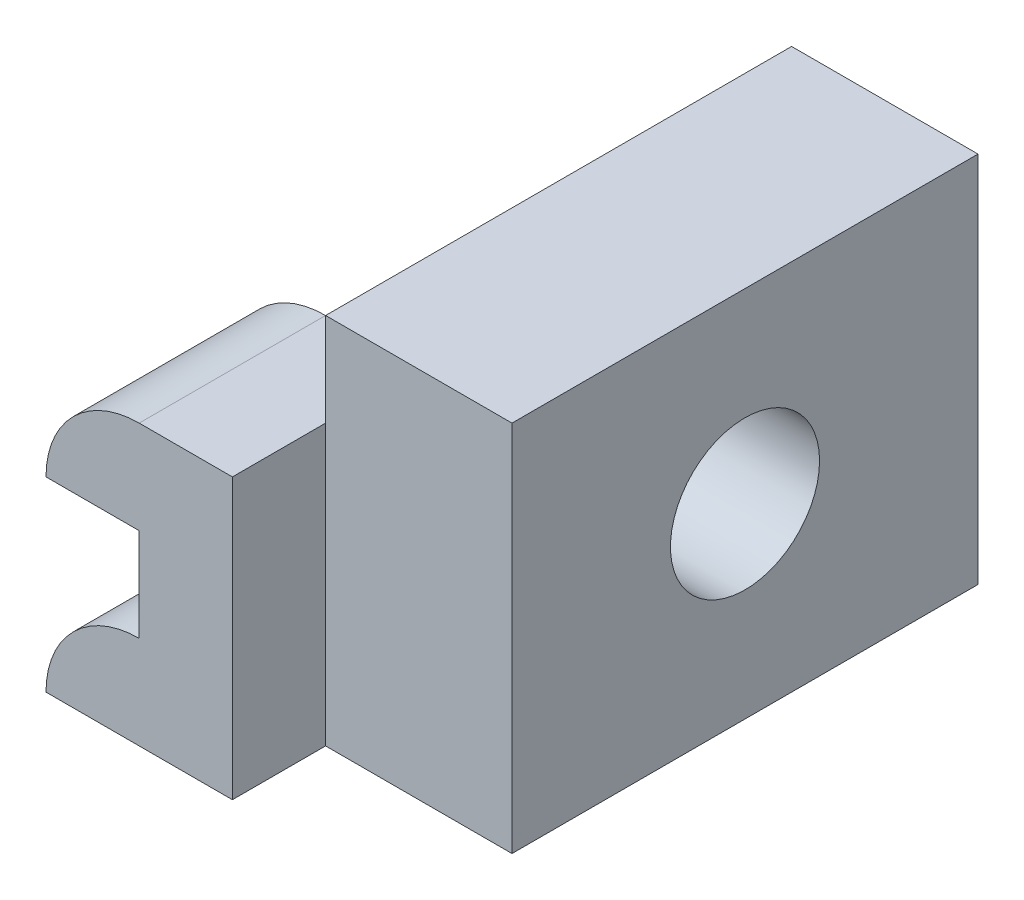
from build123d import *

# Parameters (mm, degrees)
BOSS_EXTRUDE1_DEPTH = 60
SKETCH2_W           = 40
SKETCH2_H           = 20
CUT_EXTRUDE1_DEPTH  = 20
FILLET1_R           = 10
FILLET2_R           = 10
SKETCH3_W           = 20
SKETCH3_H           = 40
CUT_EXTRUDE2_DEPTH  = 10
SKETCH4_R           = 8
CUT_EXTRUDE3_DEPTH  = 83.462112512


with BuildPart() as part:
    # Sketch1 → Boss-Extrude1 (new body)
    with BuildSketch(Plane.XY):
        Polygon((0, 0), (20, 0), (20, 40), (0, 40), (0, 30), (-20, 30), (-20, 20), (-10, 20), (-10, 10), (-20, 10), (-20, 0), align=None)
    extrude(amount=BOSS_EXTRUDE1_DEPTH)

    # Sketch2 → Cut-Extrude1 (cut)
    with BuildSketch(Plane.ZY.offset(20)):
        with Locations((20, 20)):
            Rectangle(SKETCH2_W, SKETCH2_H)
    extrude(amount=-CUT_EXTRUDE1_DEPTH, mode=Mode.SUBTRACT)

    # Fillet1
    fillet1_edges = [part.edges().sort_by_distance(p)[0] for p in [
        (-20, 10, 30),
    ]]
    fillet(fillet1_edges, radius=FILLET1_R - 0.0001)  # a hair under: the kernel refuses the full size

    # Fillet2
    fillet2_edges = [part.edges().sort_by_distance(p)[0] for p in [
        (-20, 30, 50),
    ]]
    fillet(fillet2_edges, radius=FILLET2_R - 0.0001)  # a hair under: the kernel refuses the full size

    # Sketch3 → Cut-Extrude2 (cut)
    with BuildSketch(Plane.XY.offset(60)):
        with Locations((10, 20)):
            Rectangle(SKETCH3_W, SKETCH3_H)
    extrude(amount=-CUT_EXTRUDE2_DEPTH, mode=Mode.SUBTRACT)

    # Sketch4 → Cut-Extrude3 (cut, through all)
    with BuildSketch(Plane(origin=(20, 0, 0), x_dir=(0, 0, -1), z_dir=(1, 0, 0))):
        with Locations((-25, 20)):
            Circle(SKETCH4_R)
    extrude(amount=-CUT_EXTRUDE3_DEPTH, mode=Mode.SUBTRACT)


solid = part.part
